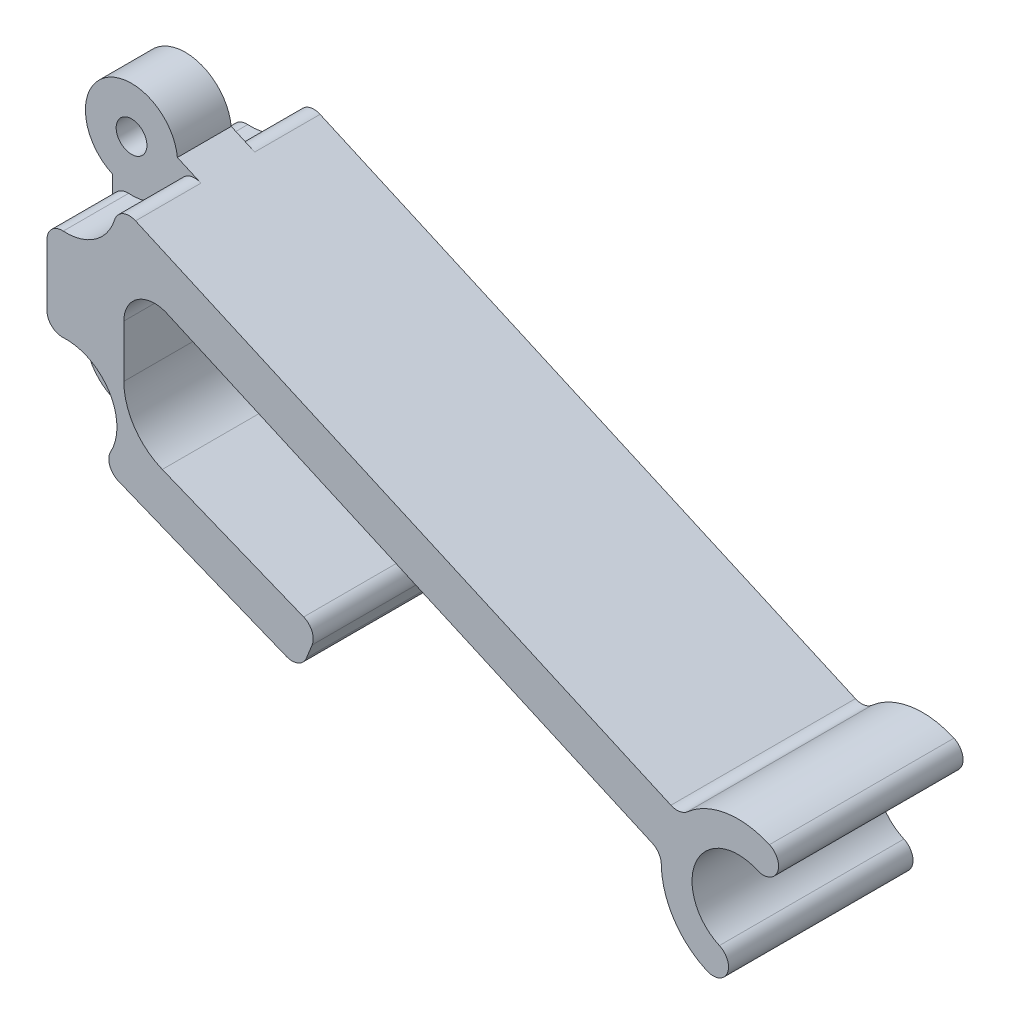
from build123d import *

# Parameters (mm, degrees)
SKETCH1_R           = 1
BOSS_EXTRUDE1_DEPTH = 12
SKETCH2_R           = 3.3
CUT_EXTRUDE1_DEPTH  = 4.25
FILLET1_R           = 1
FILLET2_R           = 1
FILLET3_R           = 2
FILLET6_R           = 1
FILLET7_R           = 4
FILLET8_R           = 1


with BuildPart() as part:
    # Sketch1 → Boss-Extrude1 (new body)
    with BuildSketch(Plane.XY):
        with BuildLine():
            Line((0.332668694, 15.169303239), (0.332668694, 22.304947181))
            ThreePointArc((0.332668694, 22.304947181), (-0.167437886, 27.468747249), (4.56623438, 25.3457106))
            Line((4.56623438, 25.3457106), (41.53945423, 8.884172534))
            ThreePointArc((41.53945423, 8.884172534), (44.223987307, 10.459606893), (47.320366603, 10.141571494))
            ThreePointArc((47.320366603, 10.141571494), (47.827175417, 8.821289393), (46.506893317, 8.314480578))
            ThreePointArc((46.506893317, 8.314480578), (42.546047014, 6.794054135), (44.066473458, 2.833207832))
            ThreePointArc((44.066473458, 2.833207832), (44.573282273, 1.512925732), (43.253000172, 1.006116917))
            ThreePointArc((43.253000172, 1.006116917), (40.944771655, 3.094367949), (40.319244301, 6.143536161))
            Line((40.319244301, 6.143536161), (5.332668694, 21.720563222))
            Line((5.332668694, 21.720563222), (5.332668694, 12.544828977))
            Line((5.332668694, 12.544828977), (17.953063304, 7.445858574))
            Line((17.953063304, 7.445858574), (16.829243524, 4.66430701))
            Line((16.829243524, 4.66430701), (3.42965312, 10.078092949))
            ThreePointArc((3.42965312, 10.078092949), (-0.980376986, 10.883023916), (0.332668694, 15.169303239))
        make_face()
        with Locations((1.582668694, 25.03212521)):
            Circle(SKETCH1_R, mode=Mode.SUBTRACT)
        with Locations((1.582668694, 12.44212521)):
            Circle(SKETCH1_R, mode=Mode.SUBTRACT)
    extrude(amount=BOSS_EXTRUDE1_DEPTH)

    # Sketch2 → Cut-Extrude1 (cut)
    with BuildSketch(Plane.XY.offset(12)):
        with Locations((1.582668694, 25.03212521)):
            Circle(SKETCH2_R)
        with Locations((1.582668694, 12.44212521)):
            Circle(SKETCH2_R)
    cut_extrude1 = extrude(amount=-CUT_EXTRUDE1_DEPTH, mode=Mode.SUBTRACT)

    # Mirror1: Cut-Extrude1 across plane
    add(cut_extrude1.mirror(Plane.XY.offset(6)), mode=Mode.SUBTRACT)

    # Fillet1
    fillet1_edges = [part.edges().sort_by_distance(p)[0] for p in [
        (0.332668694, 15.496220821, 2.125),
        (0.332668694, 15.496220821, 9.875),
        (0.332668694, 21.978029599, 2.125),
        (0.332668694, 21.978029599, 9.875),
    ]]
    fillet(fillet1_edges, radius=FILLET1_R)

    # Fillet2
    fillet2_edges = [part.edges().sort_by_distance(p)[0] for p in [
        (16.829243524, 4.66430701, 6),
        (17.953063304, 7.445858574, 6),
    ]]
    fillet(fillet2_edges, radius=FILLET2_R)

    # Fillet3
    fillet3_edges = [part.edges().sort_by_distance(p)[0] for p in [
        (5.332668694, 21.720563222, 6),
    ]]
    fillet(fillet3_edges, radius=FILLET3_R)

    # Fillet6
    fillet6_edges = [part.edges().sort_by_distance(p)[0] for p in [
        (3.746111613, 9.950235418, 2.125),
        (3.746111613, 9.950235418, 9.875),
        (4.878037932, 25.206886714, 2.125),
        (4.878037932, 25.206886714, 9.875),
    ]]
    fillet(fillet6_edges, radius=FILLET6_R)

    # Fillet7
    fillet7_edges = [part.edges().sort_by_distance(p)[0] for p in [
        (5.332668694, 12.544828977, 6),
    ]]
    fillet(fillet7_edges, radius=FILLET7_R)

    # Fillet8
    fillet8_edges = [part.edges().sort_by_distance(p)[0] for p in [
        (40.319244301, 6.143536161, 6),
        (41.53945423, 8.884172534, 6),
    ]]
    fillet(fillet8_edges, radius=FILLET8_R)


solid = part.part
